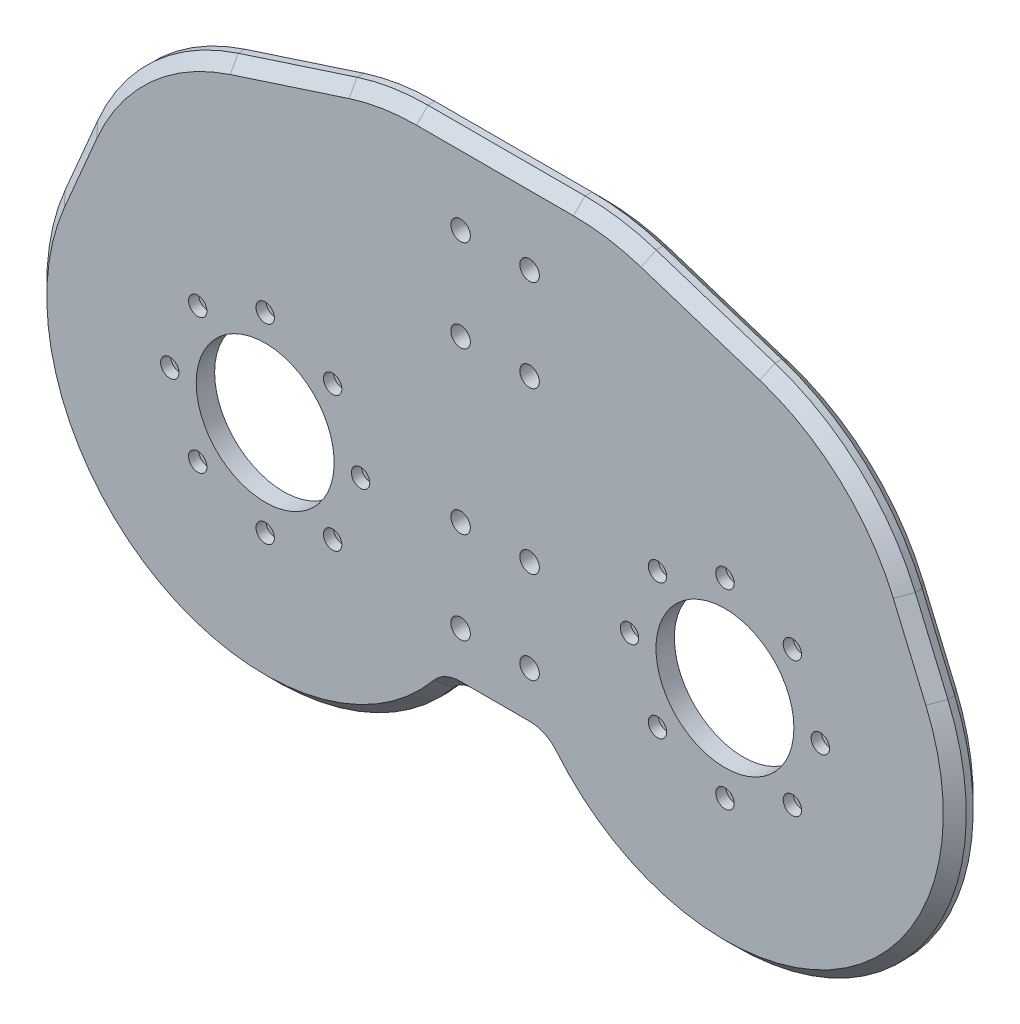
from build123d import *
from build123d.topology import SkipClean

# Parameters (mm, degrees)
SKETCH_1_R               = 30
EXTRUDE_1_DEPTH          = 8
CUT_EXTRUDE_5_DEPTH      = 905.685953271
CUT_EXTRUDE_5_DEPTH_BACK = 905.685953271
SKETCH_8_R               = 2.25
SKETCH_9_R               = 4
CUT_EXTRUDE_6_DEPTH      = 4.4
FILLET_1_R               = 100
CUT_EXTRUDE_7_DEPTH      = 83
CUT_EXTRUDE_8_DEPTH      = 83
FILLET_3_R               = 100
FILLET_4_R               = 10
SKETCH_14_R              = 4.25
CUT_EXTRUDE_9_DEPTH      = 83
EXTRUDE_2_DEPTH          = 5
FILLET_6_R               = 100
FILLET_7_R               = 10
CHAMFER_1_SIZE           = 5


with BuildPart() as part:
    # 草图1 → 凸台-拉伸1 (new body)
    with BuildSketch(Plane.XY):
        Polygon((0, 250), (769.420884294, 0), (0, 0), (-100, 0), (-869.420884294, 0), (-100, 250), align=None)
        with Locations((50, 100)):
            Circle(SKETCH_1_R, mode=Mode.SUBTRACT)
        with Locations(Location((-150, 100, 0), (0, 0, 180))):
            Circle(SKETCH_1_R, mode=Mode.SUBTRACT)
    extrude(amount=EXTRUDE_1_DEPTH)

    # 草图8 → 切除-拉伸5 (cut, two sides: drawn at the far end of the back side and taken through both)
    with BuildSketch(Plane.XY.offset(8).offset(-CUT_EXTRUDE_5_DEPTH_BACK)):
        with Locations((50, 141.5)):
            Circle(SKETCH_8_R)
        with Locations((79.344931419, 129.344931419)):
            Circle(SKETCH_8_R)
        with Locations((91.5, 100)):
            Circle(SKETCH_8_R)
        with Locations((79.344931419, 70.655068581)):
            Circle(SKETCH_8_R)
        with Locations((50, 58.5)):
            Circle(SKETCH_8_R)
        with Locations((20.655068581, 70.655068581)):
            Circle(SKETCH_8_R)
        with Locations((8.5, 100)):
            Circle(SKETCH_8_R)
        with Locations((20.655068581, 129.344931419)):
            Circle(SKETCH_8_R)
        with Locations(Location((-120.655068581, 129.344931419, 0), (0, 0, 180))):
            Circle(SKETCH_8_R)
        with Locations(Location((-108.5, 100, 0), (0, 0, 180))):
            Circle(SKETCH_8_R)
        with Locations(Location((-120.655068581, 70.655068581, 0), (0, 0, 180))):
            Circle(SKETCH_8_R)
        with Locations(Location((-150, 58.5, 0), (0, 0, 180))):
            Circle(SKETCH_8_R)
        with Locations(Location((-179.344931419, 70.655068581, 0), (0, 0, 180))):
            Circle(SKETCH_8_R)
        with Locations(Location((-191.5, 100, 0), (0, 0, 180))):
            Circle(SKETCH_8_R)
        with Locations(Location((-179.344931419, 129.344931419, 0), (0, 0, 180))):
            Circle(SKETCH_8_R)
        with Locations(Location((-150, 141.5, 0), (0, 0, 180))):
            Circle(SKETCH_8_R)
    extrude(amount=CUT_EXTRUDE_5_DEPTH + CUT_EXTRUDE_5_DEPTH_BACK, mode=Mode.SUBTRACT)

    # 草图9 → 切除-拉伸6 (cut)
    with BuildSketch(Plane.XY.offset(8)):
        with Locations((-150, 141.5)):
            Circle(SKETCH_9_R)
        with Locations((-120.655068581, 129.344931419)):
            Circle(SKETCH_9_R)
        with Locations((-108.5, 100)):
            Circle(SKETCH_9_R)
        with Locations((-120.655068581, 70.655068581)):
            Circle(SKETCH_9_R)
        with Locations((-150, 58.5)):
            Circle(SKETCH_9_R)
        with Locations((-179.344931419, 70.655068581)):
            Circle(SKETCH_9_R)
        with Locations((-191.5, 100)):
            Circle(SKETCH_9_R)
        with Locations((-179.344931419, 129.344931419)):
            Circle(SKETCH_9_R)
        with Locations(Location((79.344931419, 129.344931419, 0), (0, 0, 180))):
            Circle(SKETCH_9_R)
        with Locations(Location((91.5, 100, 0), (0, 0, 180))):
            Circle(SKETCH_9_R)
        with Locations(Location((79.344931419, 70.655068581, 0), (0, 0, 180))):
            Circle(SKETCH_9_R)
        with Locations(Location((50, 58.5, 0), (0, 0, 180))):
            Circle(SKETCH_9_R)
        with Locations(Location((20.655068581, 70.655068581, 0), (0, 0, 180))):
            Circle(SKETCH_9_R)
        with Locations(Location((8.5, 100, 0), (0, 0, 180))):
            Circle(SKETCH_9_R)
        with Locations(Location((20.655068581, 129.344931419, 0), (0, 0, 180))):
            Circle(SKETCH_9_R)
        with Locations(Location((50, 141.5, 0), (0, 0, 180))):
            Circle(SKETCH_9_R)
    extrude(amount=-CUT_EXTRUDE_6_DEPTH, mode=Mode.SUBTRACT)

    # 圆角1
    fillet_1_edges = [part.edges().sort_by_distance(p)[0] for p in [
        (-869.420884294, 0, 4),
        (769.420884294, 0, 4),
    ]]
    fillet(fillet_1_edges, radius=FILLET_1_R)

    # 草图12 → 切除-拉伸7 (cut)
    with BuildSketch(Plane(origin=(0, 0, 0), x_dir=(-1, 0, 0), z_dir=(0, 0, -1))):
        with BuildLine():
            Line((30, 40), (70, 40))
            ThreePointArc((70, 40), (105.27864045, 10.5572809), (150, 0))
            Line((150, 0), (-50, 0))
            ThreePointArc((-50, 0), (-5.27864045, 10.5572809), (30, 40))
        make_face()
    extrude(amount=-CUT_EXTRUDE_7_DEPTH, mode=Mode.SUBTRACT)

    # 草图13 → 切除-拉伸8 (cut)
    with BuildSketch(Plane.XY.offset(8)):
        with BuildLine():
            Line((-238.045732826, 0), (-150, 0))
            ThreePointArc((-150, 0), (-233.430879966, 44.870259677), (-241.990454949, 139.214234639))
            Line((-241.990454949, 139.214234639), (-210, 214.258833414))
            Line((-210, 214.258833414), (-268.947432264, 195.10565163))
            ThreePointArc((-268.947432264, 195.10565163), (-336.814566886, 84.356553496), (-238.045732826, 0))
        make_face()
        with BuildLine():
            Line((110, 214.258833414), (168.947432264, 195.10565163))
            ThreePointArc((168.947432264, 195.10565163), (236.814566886, 84.356553496), (138.045732826, 0))
            Line((138.045732826, 0), (50, 0))
            ThreePointArc((50, 0), (133.430879966, 44.870259677), (141.990454949, 139.214234639))
            Line((141.990454949, 139.214234639), (110, 214.258833414))
        make_face()
    extrude(amount=-CUT_EXTRUDE_8_DEPTH, mode=Mode.SUBTRACT)

    # 圆角3
    fillet_3_edges = [part.edges().sort_by_distance(p)[0] for p in [
        (-100, 250, 4),
        (0, 250, 4),
        (-210, 214.258833414, 4),
        (110, 214.258833414, 4),
    ]]
    fillet(fillet_3_edges, radius=FILLET_3_R)

    # 圆角4
    fillet_4_edges = [part.edges().sort_by_distance(p)[0] for p in [
        (-30, 40, 4),
        (-70, 40, 4),
    ]]
    fillet(fillet_4_edges, radius=FILLET_4_R)

    # 草图14 → 切除-拉伸9 (cut)
    with BuildSketch(Plane.XY.offset(8)):
        with Locations((-35, 65)):
            Circle(SKETCH_14_R)
        with Locations((-35, 105)):
            Circle(SKETCH_14_R)
        with Locations((-35, 175)):
            Circle(SKETCH_14_R)
        with Locations((-35, 215)):
            Circle(SKETCH_14_R)
        with Locations(Location((-65, 215, 0), (0, 0, 180))):
            Circle(SKETCH_14_R)
        with Locations(Location((-65, 175, 0), (0, 0, 180))):
            Circle(SKETCH_14_R)
        with Locations(Location((-65, 105, 0), (0, 0, 180))):
            Circle(SKETCH_14_R)
        with Locations(Location((-65, 65, 0), (0, 0, 180))):
            Circle(SKETCH_14_R)
    extrude(amount=-CUT_EXTRUDE_9_DEPTH, mode=Mode.SUBTRACT)

    # 草图15 → 凸台-拉伸2 (add)
    with SkipClean():  # the faces are left unmerged after this step: merging them gives an invalid solid
        with BuildSketch(Plane(origin=(0, 0, 0), x_dir=(-1, 0, 0), z_dir=(0, 0, -1))):
            with BuildLine():
                Line((-15.063255405, 245.10565163), (-66.7458992, 228.312942707))
                ThreePointArc((-66.7458992, 228.312942707), (-103.346666574, 206.986807031), (-127.834654711, 172.421525717))
                Line((-127.834654711, 172.421525717), (-141.990454949, 139.214234639))
                ThreePointArc((-141.990454949, 139.214234639), (-101.958670135, 14.558226857), (27.138921584, 36.363636364))
                ThreePointArc((27.138921584, 36.363636364), (30.588799415, 39.045340337), (34.852813742, 40))
                Line((34.852813742, 40), (65.147186258, 40))
                ThreePointArc((65.147186258, 40), (69.411200585, 39.045340337), (72.861078416, 36.363636364))
                ThreePointArc((72.861078416, 36.363636364), (201.958670135, 14.558226857), (241.990454949, 139.214234639))
                Line((241.990454949, 139.214234639), (227.834654711, 172.421525717))
                ThreePointArc((227.834654711, 172.421525717), (203.346666574, 206.986807031), (166.7458992, 228.312942707))
                Line((166.7458992, 228.312942707), (115.063255405, 245.10565163))
                ThreePointArc((115.063255405, 245.10565163), (99.805002472, 248.76883406), (84.161555968, 250))
                Line((84.161555968, 250), (15.838444032, 250))
                ThreePointArc((15.838444032, 250), (0.194997528, 248.76883406), (-15.063255405, 245.10565163))
            make_face()
            with BuildLine():
                Line((55, 50), (78.192966918, 50))
                ThreePointArc((78.192966918, 50), (192.379277536, 23.447750944), (230.49164808, 134.312455309))
                Line((230.49164808, 134.312455309), (199.429805152, 207.178675671))
                Line((199.429805152, 207.178675671), (98.416155597, 240))
                Line((98.416155597, 240), (55, 240))
                Line((55, 240), (55, 50))
            make_face(mode=Mode.SUBTRACT)
            with BuildLine():
                Line((45, 240), (45, 50))
                Line((45, 50), (21.807033082, 50))
                ThreePointArc((21.807033082, 50), (-92.379277536, 23.447750944), (-130.49164808, 134.312455309))
                Line((-130.49164808, 134.312455309), (-99.429805152, 207.178675671))
                Line((-99.429805152, 207.178675671), (1.583844403, 240))
                Line((1.583844403, 240), (45, 240))
            make_face(mode=Mode.SUBTRACT)
        extrude(amount=EXTRUDE_2_DEPTH)

    # 圆角6
    fillet_6_edges = [part.edges().sort_by_distance(p)[0] for p in [
        (-199.429805152, 207.178675671, -2.5),
        (99.429805152, 207.178675671, -2.5),
    ]]
    fillet(fillet_6_edges, radius=FILLET_6_R)

    # 圆角7
    fillet_7_edges = [part.edges().sort_by_distance(p)[0] for p in [
        (-98.416155597, 240, -2.5),
        (-55, 240, -2.5),
        (-55, 50, -2.5),
        (-78.192966918, 50, -2.5),
        (-21.807033082, 50, -2.5),
        (-45, 50, -2.5),
        (-45, 240, -2.5),
        (-1.583844403, 240, -2.5),
    ]]
    fillet(fillet_7_edges, radius=FILLET_7_R)

    # 倒角1
    chamfer_1_edges = [part.edges().sort_by_distance(p)[0] for p in [
        (-201.958670135, 14.558226857, 8),
        (-234.91255483, 155.817880178, 8),
        (134.91255483, 155.817880178, 8),
        (-140.904577302, 236.709297168, 8),
        (40.904577302, 236.709297168, 8),
        (-50, 250, 8),
        (-203.346666574, 206.986807031, 8),
        (-99.805002472, 248.76883406, 8),
        (-0.194997528, 248.76883406, 8),
        (103.346666574, 206.986807031, 8),
        (101.958670135, 14.558226857, 8),
        (-50, 40, 8),
        (-30.588799415, 39.045340337, 8),
        (-69.411200585, 39.045340337, 8),
        (-0.194997528, 248.76883406, -5),
        (40.904577302, 236.709297168, -5),
        (103.346666574, 206.986807031, -5),
        (134.91255483, 155.817880178, -5),
        (101.958670135, 14.558226857, -5),
        (-30.588799415, 39.045340337, -5),
        (-50, 40, -5),
        (-69.411200585, 39.045340337, -5),
        (-201.958670135, 14.558226857, -5),
        (-234.91255483, 155.817880178, -5),
        (-203.346666574, 206.986807031, -5),
        (-140.904577302, 236.709297168, -5),
        (-99.805002472, 248.76883406, -5),
        (-50, 250, -5),
    ]]
    chamfer(chamfer_1_edges, length=CHAMFER_1_SIZE - 0.0001)  # a hair under: the kernel refuses the full size


solid = part.part
